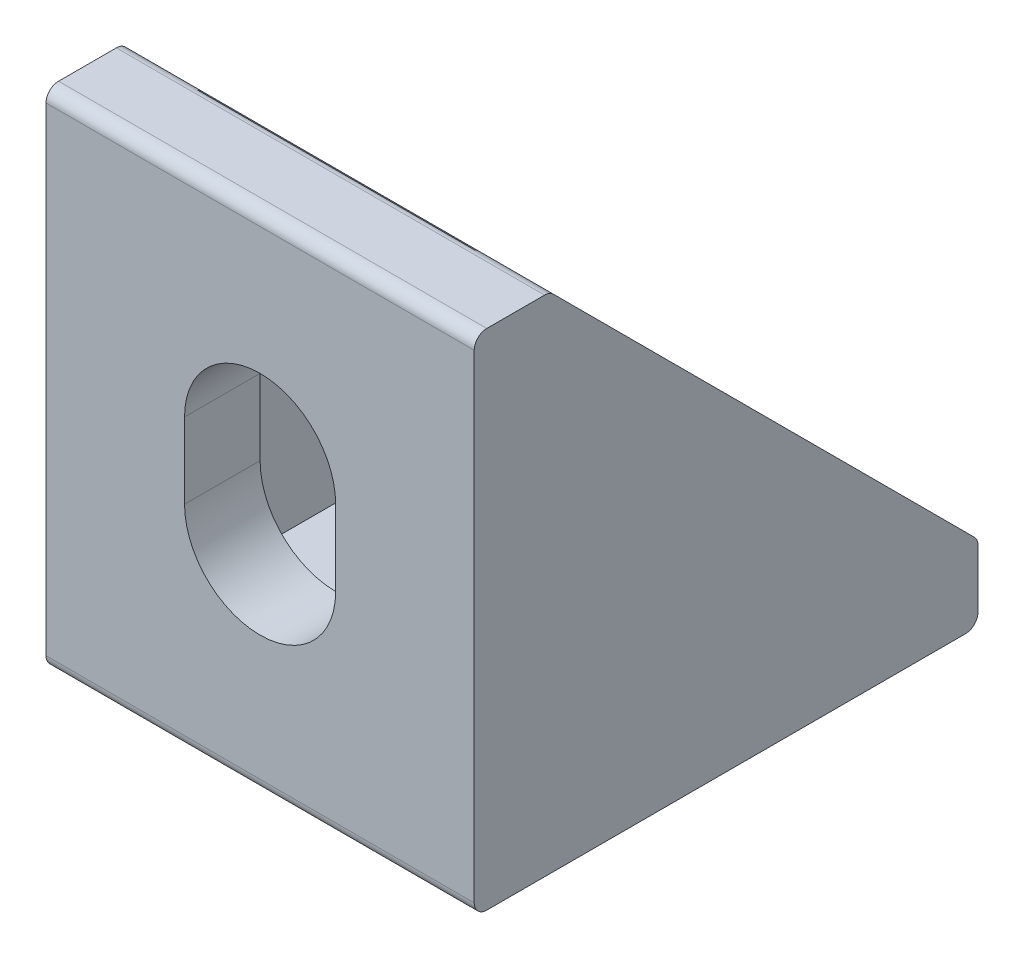
from build123d import *

# Parameters (mm, degrees)
ESTRUSIONE_ESTRUSIONE1_DEPTH = 17
SCHIZZO4_W                   = 11
SCHIZZO4_H                   = 17
TAGLIO_ESTRUSIONE3_DEPTH     = 17
RACCORDO3_START              = -1
RACCORDO3_DEPTH              = 19
TAGLIO_ESTRUSIONE4_DEPTH     = 32.272991542
TAGLIO_ESTRUSIONE5_DEPTH     = 32.272991542


with BuildPart() as part:
    # Schizzo1 → Estrusione-Estrusione1 (new body)
    with BuildSketch(Plane(origin=(0, 0, 0), x_dir=(0, 0, -1), z_dir=(1, 0, 0))):
        with BuildLine():
            Line((0, 19.5), (0, 0.5))
            ThreePointArc((0, 0.5), (0.146446609, 0.146446609), (0.5, 0))
            Line((0.5, 0), (19.5, 0))
            ThreePointArc((19.5, 0), (19.853553391, 0.146446609), (20, 0.5))
            Line((20, 0.5), (20, 3))
            Line((20, 3), (3, 20))
            Line((3, 20), (0.5, 20))
            ThreePointArc((0.5, 20), (0.146446609, 19.853553391), (0, 19.5))
        make_face()
    extrude(amount=ESTRUSIONE_ESTRUSIONE1_DEPTH)

    # Schizzo4 → Taglio-Estrusione3 (cut)
    with BuildSketch(Plane(origin=(0, 0, -20), x_dir=(-1, 0, 0), z_dir=(0, 0, -1))):
        with Locations((-8.5, 11.5)):
            Rectangle(SCHIZZO4_W, SCHIZZO4_H)
    extrude(amount=-TAGLIO_ESTRUSIONE3_DEPTH, mode=Mode.SUBTRACT)

    # Raccordo3: read off the stored shape, not the designer's step
    # Raccordo3 outline → Raccordo3 (cut)
    with BuildSketch(Plane.YZ.offset(RACCORDO3_START)):
        with BuildLine():
            Line((3, -20), (3.146446609, -19.853553391))
            ThreePointArc((3.146446609, -19.853553391), (2.984234935, -19.961939766), (2.792893219, -20))
            Line((2.792893219, -20), (3, -20))
        make_face()
        with BuildLine():
            Line((19.853553391, -3.146446609), (20, -3))
            Line((20, -3), (20, -2.792893219))
            ThreePointArc((20, -2.792893219), (19.961939766, -2.984234935), (19.853553391, -3.146446609))
        make_face()
    extrude(amount=RACCORDO3_DEPTH, mode=Mode.SUBTRACT)

    # Schizzo5 → Taglio-Estrusione4 (cut, through all)
    with BuildSketch(Plane(origin=(0, 3, 0), x_dir=(1, 0, 0), z_dir=(0, 1, 0))):
        with BuildLine():
            Line((11.5, 11.455089861), (11.5, 8.455089861))
            ThreePointArc((11.5, 8.455089861), (8.5, 5.455089861), (5.5, 8.455089861))
            Line((5.5, 8.455089861), (5.5, 11.455089861))
            ThreePointArc((5.5, 11.455089861), (8.5, 14.455089861), (11.5, 11.455089861))
        make_face()
    extrude(amount=-TAGLIO_ESTRUSIONE4_DEPTH, mode=Mode.SUBTRACT)

    # Schizzo6 → Taglio-Estrusione5 (cut, through all)
    with BuildSketch(Plane(origin=(0, 0, -3), x_dir=(-1, 0, 0), z_dir=(0, 0, -1))):
        with BuildLine():
            Line((-5.5, 11.455089861), (-5.5, 8.455089861))
            ThreePointArc((-5.5, 8.455089861), (-8.5, 5.455089861), (-11.5, 8.455089861))
            Line((-11.5, 8.455089861), (-11.5, 11.455089861))
            ThreePointArc((-11.5, 11.455089861), (-8.5, 14.455089861), (-5.5, 11.455089861))
        make_face()
    extrude(amount=-TAGLIO_ESTRUSIONE5_DEPTH, mode=Mode.SUBTRACT)


solid = part.part
